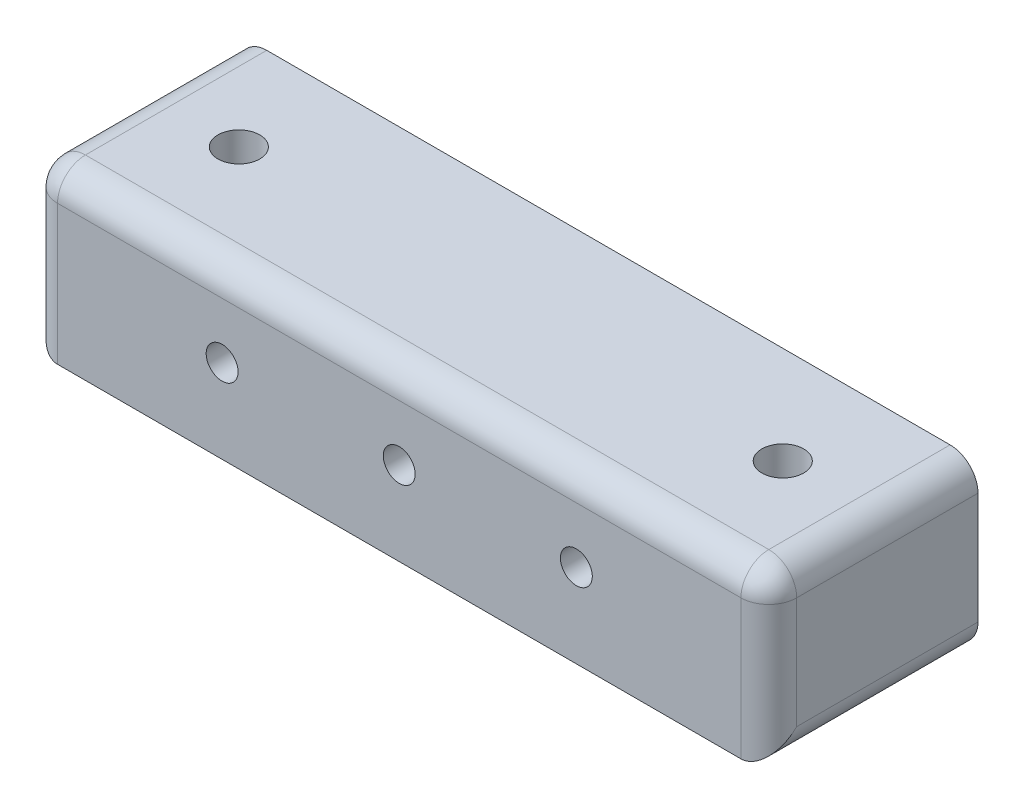
from build123d import *

# Parameters (mm, degrees)
SKETCH1_W           = 53
SKETCH1_H           = 12
BOSS_EXTRUDE1_DEPTH = 15
CUT_EXTRUDE1_REACH  = 34.73
SKETCH2_R           = 1.5
FILLET1_R           = 2
SKETCH3_R           = 1.143
CUT_EXTRUDE2_DEPTH  = 32.036269106


with BuildPart() as part:
    # Sketch1 → Boss-Extrude1 (new body)
    with BuildSketch(Plane.XY):
        Rectangle(SKETCH1_W, SKETCH1_H)
    extrude(amount=BOSS_EXTRUDE1_DEPTH)

    # Sketch2 → Cut-Extrude1 (cut, up to next)
    with BuildSketch(Plane.XZ.offset(6), mode=Mode.PRIVATE) as cut_extrude1_sk1:
        with Locations((-19.5, 7)):
            Circle(SKETCH2_R)
    cut_extrude1_tool1 = extrude(cut_extrude1_sk1.sketch, amount=-CUT_EXTRUDE1_REACH, mode=Mode.PRIVATE) & part.part
    # Sketch2 → Cut-Extrude1 (cut, up to next)
    with BuildSketch(Plane.XZ.offset(6), mode=Mode.PRIVATE) as cut_extrude1_sk2:
        with Locations((19.5, 7)):
            Circle(SKETCH2_R)
    cut_extrude1_tool2 = extrude(cut_extrude1_sk2.sketch, amount=-CUT_EXTRUDE1_REACH, mode=Mode.PRIVATE) & part.part
    add(cut_extrude1_tool1.solids().sort_by_distance((-19.5, -6, 7))[0], mode=Mode.SUBTRACT)
    add(cut_extrude1_tool2.solids().sort_by_distance((19.5, -6, 7))[0], mode=Mode.SUBTRACT)

    # Fillet1
    fillet1_edges = [part.edges().sort_by_distance(p)[0] for p in [
        (26.5, 0, 15),
        (0, 6, 15),
        (-26.5, 0, 15),
        (-26.5, 6, 7.5),
        (26.5, 6, 7.5),
        (26.5, -6, 7.5),
        (-26.5, -6, 7.5),
    ]]
    fillet(fillet1_edges, radius=FILLET1_R)

    # Sketch3 → Cut-Extrude2 (cut, through all)
    with BuildSketch(Plane(origin=(0, 0, 0), x_dir=(-1, 0, 0), z_dir=(0, 0, -1))):
        with Locations((-12.7, 0)):
            Circle(SKETCH3_R)
        with Locations((12.7, 0)):
            Circle(SKETCH3_R)
        Circle(SKETCH3_R)
    extrude(amount=-CUT_EXTRUDE2_DEPTH, mode=Mode.SUBTRACT)


solid = part.part
